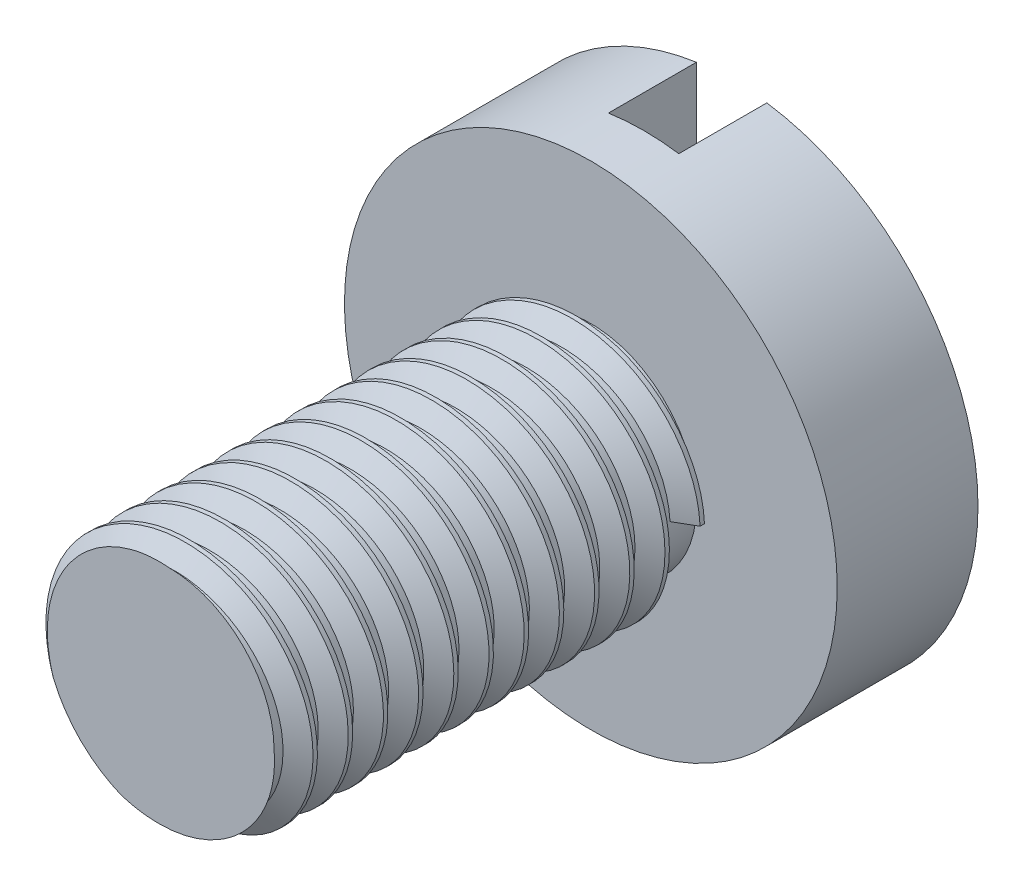
from build123d import *

# Parameters (mm, degrees)
SKETCH1_R           = 7
BOSS_EXTRUDE1_DEPTH = 4
SKETCH2_R           = 3
BOSS_EXTRUDE2_DEPTH = 12
THREAD1_PITCH       = 1
SKETCH5_R           = 7
CUT_EXTRUDE1_DEPTH  = 19.814887722
SKETCH6_W           = 2
SKETCH6_H           = 14
CUT_EXTRUDE2_DEPTH  = 2.5


with BuildPart() as part:
    # Sketch1 → Boss-Extrude1 (new body)
    with BuildSketch(Plane.XY):
        Circle(SKETCH1_R)
    extrude(amount=BOSS_EXTRUDE1_DEPTH)

    # Sketch2 → Boss-Extrude2 (add)
    with BuildSketch(Plane.XY.offset(4)):
        Circle(SKETCH2_R)
    extrude(amount=BOSS_EXTRUDE2_DEPTH)

    # Thread1: the profile of Thread Profile1 profile screwed along a right-hand helix of 15 turns, 8 arcs to a turn; built about Z, then put on its axis
    thread1_z = Axis((0, 0, 0), (0, 0, 1))
    thread1_corners = [(2.9997, 0, -0.000173205), (3.541265875, 0, 0.312499999), (3.541265875, 0, 0.437499999), (2.9997, 0, 0.750173202)]
    with BuildLine(mode=Mode.PRIVATE) as thread1_profile:
        Line(thread1_corners[0], thread1_corners[1])
        Line(thread1_corners[1], thread1_corners[2])
        Line(thread1_corners[2], thread1_corners[3])
        Line(thread1_corners[3], thread1_corners[0])
    thread1_cap = Face(thread1_profile.wire())
    thread1_turn_angles = [0, 22.5, 45, 67.5, 90, 112.5, 135, 157.5, 180, 202.5, 225, 247.5, 270, 292.5, 315, 337.5, 360]
    thread1_turn_weights = [1, 0.9238795325112867, 1, 0.9238795325112867, 1, 0.9238795325112867, 1, 0.9238795325112867, 1, 0.9238795325112867, 1, 0.9238795325112867, 1, 0.9238795325112867, 1, 0.9238795325112867, 1]
    thread1_turn_rails = [Edge.make_bspline([Vector(p[0], p[1], 0).rotate(thread1_z, thread1_turn_angles[k]) / thread1_turn_weights[k] + Vector(0, 0, p[2] + THREAD1_PITCH * thread1_turn_angles[k] / 360) for k in range(17)], [0, 0, 0, 1, 1, 2, 2, 3, 3, 4, 4, 5, 5, 6, 6, 7, 7, 8, 8, 8], 2, thread1_turn_weights) for p in thread1_corners]
    thread1_turn_sides = [Face.make_surface_from_curves(thread1_turn_rails[p[0]], thread1_turn_rails[p[1]]) for p in [(0, 1), (1, 2), (2, 3), (3, 0)]]
    thread1 = Plane(origin=(0, 0, 4), x_dir=(1, 0, 0), z_dir=(0, 0, 1)) * Solid(Shell([*[p.moved(Location((0, 0, THREAD1_PITCH * i))) for i in range(15) for p in thread1_turn_sides], thread1_cap, thread1_cap.rotate(thread1_z, 5400).moved(Location((0, 0, THREAD1_PITCH * 5400 / 360)))]))
    add(thread1)

    # Sketch5 → Cut-Extrude1 (cut, through all)
    with BuildSketch(Plane.XY.offset(16)):
        Circle(SKETCH5_R)
    extrude(amount=CUT_EXTRUDE1_DEPTH, mode=Mode.SUBTRACT)

    # Sketch6 → Cut-Extrude2 (cut)
    with BuildSketch(Plane(origin=(0, 0, 0), x_dir=(-1, 0, 0), z_dir=(0, 0, -1))):
        Rectangle(SKETCH6_W, SKETCH6_H)
    extrude(amount=-CUT_EXTRUDE2_DEPTH, mode=Mode.SUBTRACT)


solid = part.part
